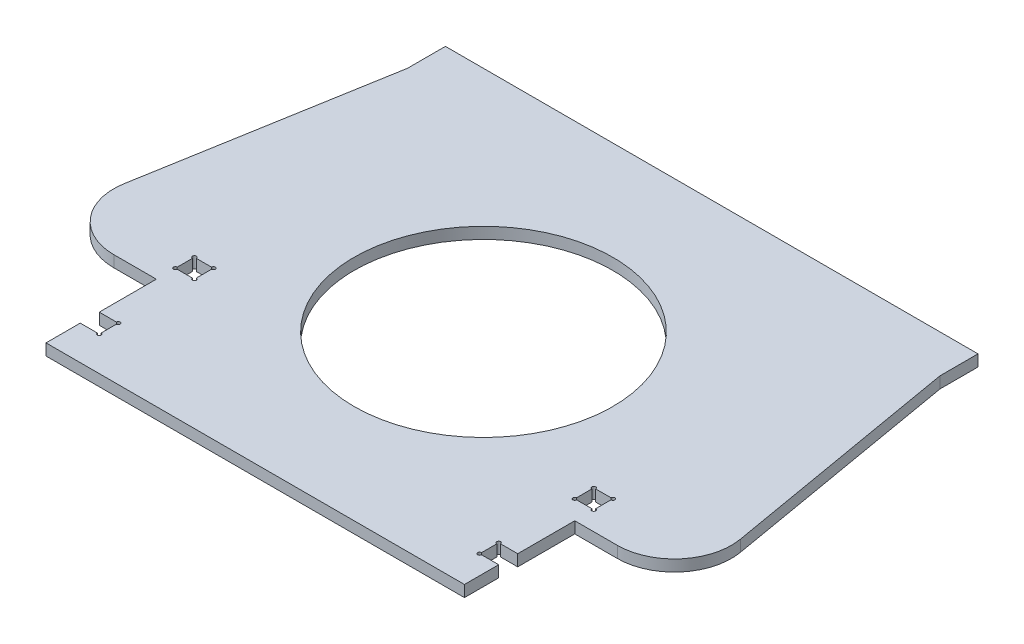
from build123d import *

# Parameters (mm, degrees)
SKETCH1_W           = 5
SKETCH1_H           = 5
BOSS_EXTRUDE1_DEPTH = 3
SKETCH2_R           = 34
CUT_EXTRUDE1_DEPTH  = 3
FILLET1_R           = 15
CUT_EXTRUDE2_DEPTH  = 145.913784817


with BuildPart() as part:
    # Sketch1 → Boss-Extrude1 (new body)
    with BuildSketch(Plane(origin=(0, 0, 0), x_dir=(1, 0, 0), z_dir=(0, 1, 0))):
        Polygon((70, 110), (70, 120), (-70, 120), (-70, 110), (-84, 29), (-55, 29), (-55, 14), (-50, 14), (-50, 9), (-55, 9), (-55, 0), (55, 0), (55, 9), (50, 9), (50, 14), (55, 14), (55, 29), (84, 29), align=None)
        with Locations((52.5, 36.5)):
            Rectangle(SKETCH1_W, SKETCH1_H, mode=Mode.SUBTRACT)
        with Locations((-52.5, 36.5)):
            Rectangle(SKETCH1_W, SKETCH1_H, mode=Mode.SUBTRACT)
    extrude(amount=BOSS_EXTRUDE1_DEPTH)

    # Sketch2 → Cut-Extrude1 (cut)
    with BuildSketch(Plane(origin=(0, 3, 0), x_dir=(1, 0, 0), z_dir=(0, 1, 0))):
        with Locations((0, 60)):
            Circle(SKETCH2_R)
    extrude(amount=-CUT_EXTRUDE1_DEPTH, mode=Mode.SUBTRACT)

    # Fillet1
    fillet1_edges = [part.edges().sort_by_distance(p)[0] for p in [
        (84, 1.5, -29),
        (-84, 1.5, -29),
    ]]
    fillet(fillet1_edges, radius=FILLET1_R)

    # Sketch4 → Cut-Extrude2 (cut, through all)
    with BuildSketch(Plane(origin=(0, 3, 0), x_dir=(1, 0, 0), z_dir=(0, 1, 0))):
        with BuildLine():
            ThreePointArc((55, 38.5), (55.353553391, 39.353553391), (54.5, 39))
            Line((54.5, 39), (55, 39))
            Line((55, 39), (55, 38.5))
        make_face()
        with BuildLine():
            Line((50, 39), (50.5, 39))
            ThreePointArc((50.5, 39), (49.646446609, 39.353553391), (50, 38.5))
            Line((50, 38.5), (50, 39))
        make_face()
        with BuildLine():
            ThreePointArc((54.5, 34), (55.353553391, 33.646446609), (55, 34.5))
            Line((55, 34.5), (55, 34))
            Line((55, 34), (54.5, 34))
        make_face()
        with BuildLine():
            Line((50, 34), (50, 34.5))
            ThreePointArc((50, 34.5), (49.646446609, 33.646446609), (50.5, 34))
            Line((50.5, 34), (50, 34))
        make_face()
        with BuildLine():
            Line((50, 14), (50.5, 14))
            ThreePointArc((50.5, 14), (49.646446609, 14.353553391), (50, 13.5))
            Line((50, 13.5), (50, 14))
        make_face()
        with BuildLine():
            Line((50, 9), (50, 9.5))
            ThreePointArc((50, 9.5), (49.646446609, 8.646446609), (50.5, 9))
            Line((50.5, 9), (50, 9))
        make_face()
        with BuildLine():
            Line((-50, 14), (-50, 13.5))
            ThreePointArc((-50, 13.5), (-49.646446609, 14.353553391), (-50.5, 14))
            Line((-50.5, 14), (-50, 14))
        make_face()
        with BuildLine():
            ThreePointArc((-50.5, 9), (-49.646446609, 8.646446609), (-50, 9.5))
            Line((-50, 9.5), (-50, 9))
            Line((-50, 9), (-50.5, 9))
        make_face()
        with BuildLine():
            ThreePointArc((-50.5, 34), (-49.646446609, 33.646446609), (-50, 34.5))
            Line((-50, 34.5), (-50, 34))
            Line((-50, 34), (-50.5, 34))
        make_face()
        with BuildLine():
            Line((-50, 39), (-50, 38.5))
            ThreePointArc((-50, 38.5), (-49.646446609, 39.353553391), (-50.5, 39))
            Line((-50.5, 39), (-50, 39))
        make_face()
        with BuildLine():
            ThreePointArc((-55, 34.5), (-55.353553391, 33.646446609), (-54.5, 34))
            Line((-54.5, 34), (-55, 34))
            Line((-55, 34), (-55, 34.5))
        make_face()
        with BuildLine():
            Line((-55, 39), (-54.5, 39))
            ThreePointArc((-54.5, 39), (-55.353553391, 39.353553391), (-55, 38.5))
            Line((-55, 38.5), (-55, 39))
        make_face()
    extrude(amount=-CUT_EXTRUDE2_DEPTH, mode=Mode.SUBTRACT)


solid = part.part
